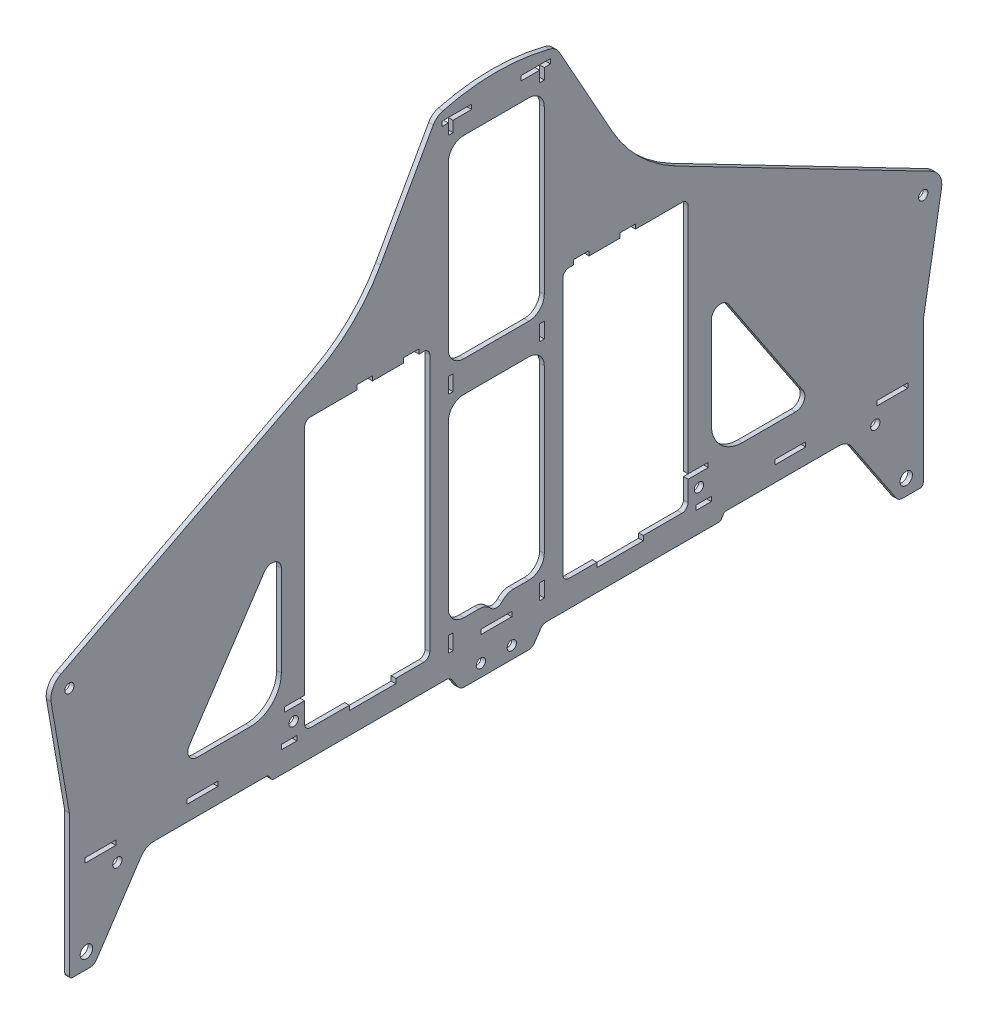
from build123d import *

# Parameters (mm, degrees)
SZKIC1_R                    = 4
SZKIC1_W                    = 20
SZKIC1_H                    = 3
SZKIC1_R_2                  = 3
SZKIC1_W_2                  = 10
SZKIC1_W_3                  = 3
SZKIC1_H_2                  = 10
DODANIE_WYCI_GNI_CIE1_DEPTH = 3


with BuildPart() as part:
    # Szkic1 → Dodanie-wyciągnięcie1 (new body)
    with BuildSketch(Plane(origin=(0, 0, 0), x_dir=(0, 0, -1), z_dir=(1, 0, 0))):
        with BuildLine():
            ThreePointArc((-32.751772428, -79.118413122), (-30.3924828, -79.710040128), (-28.591520956, -81.344912141))
            Line((-28.591520956, -81.344912141), (-24.893519648, -86.891914103))
            ThreePointArc((-24.893519648, -86.891914103), (-23.092557804, -88.526786116), (-20.733268176, -89.118413122))
            Line((-20.733268176, -89.118413122), (-0.075853635, -89.118413122))
            Line((-0.075853635, -89.118413122), (20.581560906, -89.118413122))
            ThreePointArc((20.581560906, -89.118413122), (22.940850533, -88.526786116), (24.741812377, -86.891914103))
            Line((24.741812377, -86.891914103), (28.439813685, -81.344912141))
            ThreePointArc((28.439813685, -81.344912141), (30.24077553, -79.710040128), (32.600065157, -79.118413122))
            Line((32.600065157, -79.118413122), (143.704861181, -79.118413122))
            ThreePointArc((143.704861181, -79.118413122), (144.648577032, -78.88176232), (145.368961769, -78.227813514))
            Line((145.368961769, -78.227813514), (146.848162293, -76.00901273))
            ThreePointArc((146.848162293, -76.00901273), (147.56854703, -75.355063924), (148.512262881, -75.118413122))
            Line((148.512262881, -75.118413122), (221.238975447, -75.118413122))
            ThreePointArc((221.238975447, -75.118413122), (225.957554702, -76.301667134), (229.55947839, -79.57141116))
            Line((229.55947839, -79.57141116), (258.439813686, -122.891914103))
            ThreePointArc((258.439813686, -122.891914103), (260.24077553, -124.526786116), (262.600065157, -125.118413122))
            Line((262.600065157, -125.118413122), (273.924146365, -125.118413122))
            ThreePointArc((273.924146365, -125.118413122), (275.338359927, -124.532626684), (275.924146365, -123.118413122))
            Line((275.924146365, -123.118413122), (275.924146365, -32.118413122))
            Line((275.924146365, -32.118413122), (287.624871531, 35.218312469))
            Line((287.624871531, 35.218312469), (287.837433065, 36.441586878))
            ThreePointArc((287.837433065, 36.441586878), (286.532907961, 43.489989271), (281.442987968, 48.537213906))
            Line((281.442987968, 48.537213906), (116.209752868, 134.116039984))
            ThreePointArc((116.209752868, 134.116039984), (92.570426742, 151.137527581), (74.839518006, 174.249508352))
            Line((74.839518006, 174.249508352), (40.647315064, 235.631353629))
            ThreePointArc((40.647315064, 235.631353629), (38.036680829, 238.669388657), (34.443218164, 240.439160964))
            ThreePointArc((34.443218164, 240.439160964), (17.32602461, 243.766419526), (-0.075853635, 244.881586878))
            ThreePointArc((-0.075853635, 244.881586878), (-17.477731881, 243.766419526), (-34.594925435, 240.439160964))
            ThreePointArc((-34.594925435, 240.439160964), (-38.188388099, 238.669388657), (-40.799022334, 235.631353629))
            Line((-40.799022334, 235.631353629), (-74.991225276, 174.249508352))
            ThreePointArc((-74.991225276, 174.249508352), (-92.722134012, 151.137527581), (-116.361460139, 134.116039984))
            Line((-116.361460139, 134.116039984), (-281.594695239, 48.537213906))
            ThreePointArc((-281.594695239, 48.537213906), (-286.684615231, 43.489989271), (-287.989140335, 36.441586878))
            Line((-287.989140335, 36.441586878), (-287.776578802, 35.218312469))
            Line((-287.776578802, 35.218312469), (-276.075853635, -32.118413122))
            Line((-276.075853635, -32.118413122), (-276.075853635, -123.118413122))
            ThreePointArc((-276.075853635, -123.118413122), (-275.490067198, -124.532626684), (-274.075853635, -125.118413122))
            Line((-274.075853635, -125.118413122), (-262.751772428, -125.118413122))
            ThreePointArc((-262.751772428, -125.118413122), (-260.3924828, -124.526786116), (-258.591520956, -122.891914103))
            Line((-258.591520956, -122.891914103), (-229.71118566, -79.57141116))
            ThreePointArc((-229.71118566, -79.57141116), (-226.109261972, -76.301667134), (-221.390682717, -75.118413122))
            Line((-221.390682717, -75.118413122), (-148.663970152, -75.118413122))
            ThreePointArc((-148.663970152, -75.118413122), (-147.720254301, -75.355063924), (-146.999869563, -76.00901273))
            Line((-146.999869563, -76.00901273), (-145.52066904, -78.227813514))
            ThreePointArc((-145.52066904, -78.227813514), (-144.800284302, -78.88176232), (-143.856568451, -79.118413122))
            Line((-143.856568451, -79.118413122), (-32.751772428, -79.118413122))
        make_face()
        with Locations((-265.075853635, -115.118413122)):
            Circle(SZKIC1_R, mode=Mode.SUBTRACT)
        with Locations((-256.075853635, -63.618413122)):
            Rectangle(SZKIC1_W, SZKIC1_H, mode=Mode.SUBTRACT)
        with Locations((-245.075853635, -75.118413122)):
            Circle(SZKIC1_R_2, mode=Mode.SUBTRACT)
        with Locations((-190.075853635, -63.618413122)):
            Rectangle(SZKIC1_W, SZKIC1_H, mode=Mode.SUBTRACT)
        with Locations((-10.075853635, -81.118413122)):
            Circle(SZKIC1_R_2, mode=Mode.SUBTRACT)
        with Locations((-134.075853635, -63.618413122)):
            Rectangle(SZKIC1_W_2, SZKIC1_H, mode=Mode.SUBTRACT)
        with Locations((-131.075853635, -53.118413122)):
            Circle(SZKIC1_R_2, mode=Mode.SUBTRACT)
        with Locations((-29.575853635, -60.118413122)):
            Rectangle(SZKIC1_W_3, SZKIC1_H_2, mode=Mode.SUBTRACT)
        with BuildLine():
            ThreePointArc((-139.075853635, -22.118413122), (-144.933718012, -36.260548746), (-159.075853635, -42.118413122))
            Line((-159.075853635, -42.118413122), (-193.531417751, -42.118413122))
            ThreePointArc((-193.531417751, -42.118413122), (-198.821465344, -38.949560675), (-198.523719517, -32.790211945))
            Line((-198.523719517, -32.790211945), (-150.068155401, 39.893134229))
            ThreePointArc((-150.068155401, 39.893134229), (-143.337148743, 42.307485211), (-139.075853635, 36.564933052))
            Line((-139.075853635, 36.564933052), (-139.075853635, -22.118413122))
        make_face(mode=Mode.SUBTRACT)
        with Locations((-276.075853635, 37.881586878)):
            Circle(SZKIC1_R_2, mode=Mode.SUBTRACT)
        with BuildLine():
            Line((-60.075853635, 114.881586878), (-50.075853635, 114.881586878))
            Line((-50.075853635, 114.881586878), (-50.075853635, 111.881586878))
            Line((-50.075853635, 111.881586878), (-47.075853635, 111.881586878))
            ThreePointArc((-47.075853635, 111.881586878), (-44.247426511, 110.710014003), (-43.075853635, 107.881586878))
            Line((-43.075853635, 107.881586878), (-43.075853635, -58.118413122))
            ThreePointArc((-43.075853635, -58.118413122), (-44.247426511, -60.946840247), (-47.075853635, -62.118413122))
            Line((-47.075853635, -62.118413122), (-65.075853635, -62.118413122))
            Line((-65.075853635, -62.118413122), (-65.075853635, -65.118413122))
            Line((-65.075853635, -65.118413122), (-95.075853635, -65.118413122))
            Line((-95.075853635, -65.118413122), (-95.075853635, -62.118413122))
            Line((-95.075853635, -62.118413122), (-120.075853635, -62.118413122))
            ThreePointArc((-120.075853635, -62.118413122), (-122.90428076, -60.946840247), (-124.075853635, -58.118413122))
            Line((-124.075853635, -58.118413122), (-124.075853635, -45.118413122))
            Line((-124.075853635, -45.118413122), (-137.075853635, -45.118413122))
            Line((-137.075853635, -45.118413122), (-137.075853635, -42.118413122))
            Line((-137.075853635, -42.118413122), (-124.075853635, -42.118413122))
            Line((-124.075853635, -42.118413122), (-124.075853635, 107.881586878))
            ThreePointArc((-124.075853635, 107.881586878), (-122.90428076, 110.710014003), (-120.075853635, 111.881586878))
            Line((-120.075853635, 111.881586878), (-90.075853635, 111.881586878))
            Line((-90.075853635, 111.881586878), (-90.075853635, 114.881586878))
            Line((-90.075853635, 114.881586878), (-80.075853635, 114.881586878))
            Line((-80.075853635, 114.881586878), (-80.075853635, 111.881586878))
            Line((-80.075853635, 111.881586878), (-60.075853635, 111.881586878))
            Line((-60.075853635, 111.881586878), (-60.075853635, 114.881586878))
        make_face(mode=Mode.SUBTRACT)
        with Locations((9.924146365, -81.118413122)):
            Circle(SZKIC1_R_2, mode=Mode.SUBTRACT)
        Polygon((-10.075853635, -65.118413122), (-10.075853635, -62.118413122), (-0.075853635, -62.118413122), (9.924146365, -62.118413122), (9.924146365, -65.118413122), (-0.075853635, -65.118413122), align=None, mode=Mode.SUBTRACT)
        with Locations((29.424146365, -60.118413122)):
            Rectangle(SZKIC1_W_3, SZKIC1_H_2, mode=Mode.SUBTRACT)
        with Locations((133.924146365, -63.618413122)):
            Rectangle(SZKIC1_W_2, SZKIC1_H, mode=Mode.SUBTRACT)
        with Locations((130.924146365, -53.118413122)):
            Circle(SZKIC1_R_2, mode=Mode.SUBTRACT)
        with Locations((264.924146365, -115.118413122)):
            Circle(SZKIC1_R, mode=Mode.SUBTRACT)
        with Locations((189.924146365, -63.618413122)):
            Rectangle(SZKIC1_W, SZKIC1_H, mode=Mode.SUBTRACT)
        with Locations((244.924146365, -75.118413122)):
            Circle(SZKIC1_R_2, mode=Mode.SUBTRACT)
        with Locations((255.924146365, -63.618413122)):
            Rectangle(SZKIC1_W, SZKIC1_H, mode=Mode.SUBTRACT)
        with BuildLine():
            Line((-11.256193523, -50.118413122), (-21.075853635, -50.118413122))
            ThreePointArc((-21.075853635, -50.118413122), (-28.146921447, -47.189480934), (-31.075853635, -40.118413122))
            Line((-31.075853635, -40.118413122), (-31.075853635, 64.881586878))
            ThreePointArc((-31.075853635, 64.881586878), (-28.146921447, 71.95265469), (-21.075853635, 74.881586878))
            Line((-21.075853635, 74.881586878), (-0.075853635, 74.881586878))
            Line((-0.075853635, 74.881586878), (20.924146365, 74.881586878))
            ThreePointArc((20.924146365, 74.881586878), (27.995214177, 71.95265469), (30.924146365, 64.881586878))
            Line((30.924146365, 64.881586878), (30.924146365, -40.118413122))
            ThreePointArc((30.924146365, -40.118413122), (27.995214177, -47.189480934), (20.924146365, -50.118413122))
            Line((20.924146365, -50.118413122), (11.104486252, -50.118413122))
            ThreePointArc((11.104486252, -50.118413122), (7.022003348, -50.98970383), (3.650926327, -53.451746455))
            ThreePointArc((3.650926327, -53.451746455), (1.965387817, -54.682767768), (-0.075853635, -55.118413122))
            ThreePointArc((-0.075853635, -55.118413122), (-2.117095088, -54.682767768), (-3.802633598, -53.451746455))
            ThreePointArc((-3.802633598, -53.451746455), (-7.173710618, -50.98970383), (-11.256193523, -50.118413122))
        make_face(mode=Mode.SUBTRACT)
        with BuildLine():
            Line((49.924146365, 111.881586878), (49.924146365, 114.881586878))
            Line((49.924146365, 114.881586878), (59.924146365, 114.881586878))
            Line((59.924146365, 114.881586878), (59.924146365, 111.881586878))
            Line((59.924146365, 111.881586878), (79.924146365, 111.881586878))
            Line((79.924146365, 111.881586878), (79.924146365, 114.881586878))
            Line((79.924146365, 114.881586878), (89.924146365, 114.881586878))
            Line((89.924146365, 114.881586878), (89.924146365, 111.881586878))
            Line((89.924146365, 111.881586878), (119.924146365, 111.881586878))
            ThreePointArc((119.924146365, 111.881586878), (122.752573489, 110.710014003), (123.924146365, 107.881586878))
            Line((123.924146365, 107.881586878), (123.924146365, -42.118413122))
            Line((123.924146365, -42.118413122), (136.924146365, -42.118413122))
            Line((136.924146365, -42.118413122), (136.924146365, -45.118413122))
            Line((136.924146365, -45.118413122), (123.924146365, -45.118413122))
            Line((123.924146365, -45.118413122), (123.924146365, -58.118413122))
            ThreePointArc((123.924146365, -58.118413122), (122.752573489, -60.946840247), (119.924146365, -62.118413122))
            Line((119.924146365, -62.118413122), (94.924146365, -62.118413122))
            Line((94.924146365, -62.118413122), (94.924146365, -65.118413122))
            Line((94.924146365, -65.118413122), (64.924146365, -65.118413122))
            Line((64.924146365, -65.118413122), (64.924146365, -62.118413122))
            Line((64.924146365, -62.118413122), (46.924146365, -62.118413122))
            ThreePointArc((46.924146365, -62.118413122), (44.09571924, -60.946840247), (42.924146365, -58.118413122))
            Line((42.924146365, -58.118413122), (42.924146365, 107.881586878))
            ThreePointArc((42.924146365, 107.881586878), (44.09571924, 110.710014003), (46.924146365, 111.881586878))
            Line((46.924146365, 111.881586878), (49.924146365, 111.881586878))
        make_face(mode=Mode.SUBTRACT)
        with BuildLine():
            Line((193.379710481, -42.118413122), (158.924146365, -42.118413122))
            ThreePointArc((158.924146365, -42.118413122), (144.782010741, -36.260548746), (138.924146365, -22.118413122))
            Line((138.924146365, -22.118413122), (138.924146365, 36.564933052))
            ThreePointArc((138.924146365, 36.564933052), (143.185441473, 42.307485211), (149.916448131, 39.893134229))
            Line((149.916448131, 39.893134229), (198.372012247, -32.790211945))
            ThreePointArc((198.372012247, -32.790211945), (198.669758073, -38.949560675), (193.379710481, -42.118413122))
        make_face(mode=Mode.SUBTRACT)
        with Locations((275.924146365, 37.881586878)):
            Circle(SZKIC1_R_2, mode=Mode.SUBTRACT)
        with Locations((-29.575853635, 84.881586878)):
            Rectangle(SZKIC1_W_3, SZKIC1_H_2, mode=Mode.SUBTRACT)
        Polygon((-35.075853635, 231.881586878), (-35.075853635, 234.881586878), (-16.075853635, 234.881586878), (-16.075853635, 231.881586878), (-28.075853635, 231.881586878), (-28.075853635, 224.881586878), (-31.075853635, 224.881586878), (-31.075853635, 231.881586878), align=None, mode=Mode.SUBTRACT)
        with Locations((29.424146365, 84.881586878)):
            Rectangle(SZKIC1_W_3, SZKIC1_H_2, mode=Mode.SUBTRACT)
        with BuildLine():
            Line((-21.075853635, 219.881586878), (-0.075853635, 219.881586878))
            Line((-0.075853635, 219.881586878), (20.924146365, 219.881586878))
            ThreePointArc((20.924146365, 219.881586878), (27.995214177, 216.95265469), (30.924146365, 209.881586878))
            Line((30.924146365, 209.881586878), (30.924146365, 104.881586878))
            ThreePointArc((30.924146365, 104.881586878), (27.995214177, 97.810519066), (20.924146365, 94.881586878))
            Line((20.924146365, 94.881586878), (-0.075853635, 94.881586878))
            Line((-0.075853635, 94.881586878), (-21.075853635, 94.881586878))
            ThreePointArc((-21.075853635, 94.881586878), (-28.146921447, 97.810519066), (-31.075853635, 104.881586878))
            Line((-31.075853635, 104.881586878), (-31.075853635, 209.881586878))
            ThreePointArc((-31.075853635, 209.881586878), (-28.146921447, 216.95265469), (-21.075853635, 219.881586878))
        make_face(mode=Mode.SUBTRACT)
        Polygon((15.924146365, 234.881586878), (34.924146365, 234.881586878), (34.924146365, 231.881586878), (30.924146365, 231.881586878), (30.924146365, 224.881586878), (27.924146365, 224.881586878), (27.924146365, 231.881586878), (15.924146365, 231.881586878), align=None, mode=Mode.SUBTRACT)
    extrude(amount=DODANIE_WYCI_GNI_CIE1_DEPTH)


solid = part.part
